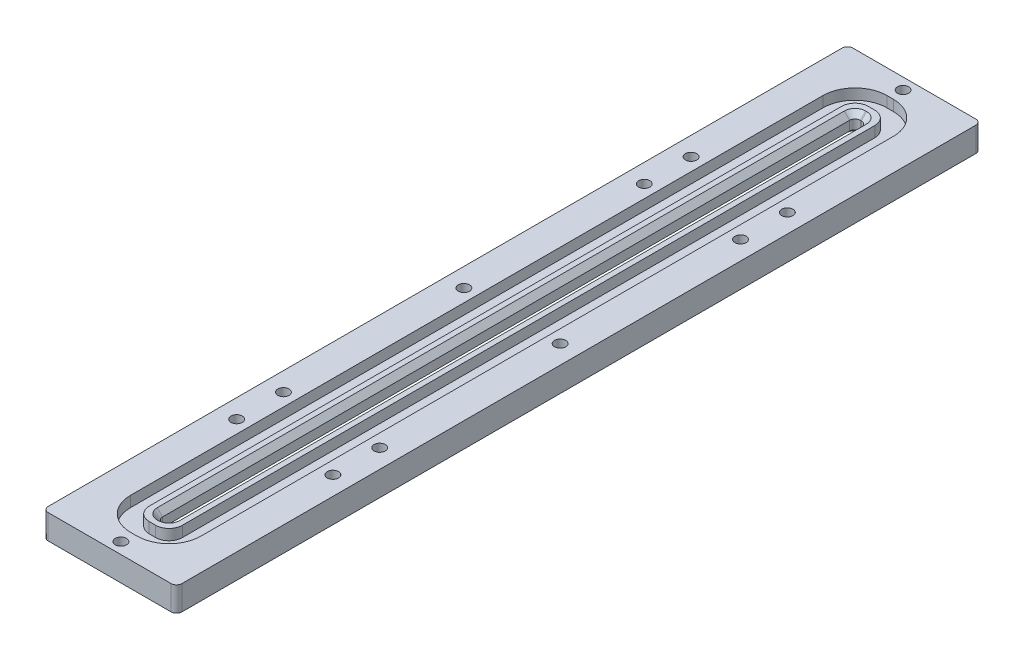
from build123d import *

# Parameters (mm, degrees)
BOSS_EXTRUDE1_DEPTH   = 137.5
SKETCH3_W             = 20
SKETCH3_H             = 9.2
BOSS_EXTRUDE2_DEPTH   = 2
SKETCH2_W             = 4.4
SKETCH2_H             = 261
CUT_EXTRUDE1_DEPTH    = 139.169786857
FILLET3_R             = 2
CHAMFER1_SIZE         = 1
SKETCH4_W             = 10.203047284
SKETCH4_H             = 4
CUT_EXTRUDE2_DEPTH    = 1
CHAMFER4_SIZE         = 2
SKETCH5_W             = 20
SKETCH5_H             = 275
BOSS_EXTRUDE3_DEPTH   = 9.2
M5_TAPPED_HOLE1_D     = 4.2
CRVPATTERN1_START     = -2.7
CRVPATTERN1_OUTLINE_R = 2.1
CRVPATTERN1_DEPTH     = 9.2
CUT_EXTRUDE3_DEPTH    = 4
M5_TAPPED_HOLE2_D     = 4.2
M5_TAPPED_HOLE2_DEPTH = 11.1381927
M5_TAPPED_HOLE2_TIP   = 1.2618073
FILLET4_R             = 2
CHAMFER5_SIZE         = 0.5


# Read off the part's stored shape, not the designer's step: CrvPattern1
with BuildPart() as part:
    # Sketch1 → Boss-Extrude1 (new, symmetric)
    with BuildSketch(Plane.XY):
        Polygon((-10, -2.7), (-10, 6.5), (10, 6.5), (10, -2.7), (8, -2.7), (8, 1), (4.2, 1), (4.2, 0), (-4.2, 0), (-4.2, 1), (-8, 1), (-8, -2.7), align=None)
    extrude(amount=BOSS_EXTRUDE1_DEPTH, both=True)

    # Sketch3 → Boss-Extrude2 (add)
    with BuildSketch(Plane.XY.offset(137.5)):
        with Locations((0, 1.9)):
            Rectangle(SKETCH3_W, SKETCH3_H)
    boss_extrude2 = extrude(amount=-BOSS_EXTRUDE2_DEPTH)

    # Mirror1: Boss-Extrude2 across plane
    add(boss_extrude2.mirror(Plane.XY))

    # Sketch2 → Cut-Extrude1 (cut, through all)
    with BuildSketch(Plane(origin=(0, 6.5, 0), x_dir=(1, 0, 0), z_dir=(0, 1, 0))):
        Rectangle(SKETCH2_W, SKETCH2_H)
    extrude(amount=-CUT_EXTRUDE1_DEPTH, mode=Mode.SUBTRACT)

    # Fillet3
    fillet3_edges = [part.edges().sort_by_distance(p)[0] for p in [
        (2.2, 3.25, -130.5),
        (2.2, 3.25, 130.5),
        (-2.2, 3.25, 130.5),
        (-2.2, 3.25, -130.5),
    ]]
    fillet(fillet3_edges, radius=FILLET3_R)

    # Chamfer1
    chamfer1_edges = [part.edges().sort_by_distance(p)[0] for p in [
        (-2.2, 0, 0),
        (0, 0, -130.5),
        (2.2, 0, 0),
        (0, 0, 130.5),
        (-1.614213562, 0, -129.914213562),
        (1.614213562, 0, -129.914213562),
        (1.614213562, 0, 129.914213562),
        (-1.614213562, 0, 129.914213562),
    ]]
    chamfer(chamfer1_edges, length=CHAMFER1_SIZE)

    # Sketch4 → Cut-Extrude2 (cut)
    with BuildSketch(Plane.XZ):
        with Locations((-0.901523642, 133.5)):
            Rectangle(SKETCH4_W, SKETCH4_H)
    cut_extrude2 = extrude(amount=-CUT_EXTRUDE2_DEPTH, mode=Mode.SUBTRACT)

    # Mirror2: Cut-Extrude2 across plane
    add(cut_extrude2.mirror(Plane.XY), mode=Mode.SUBTRACT)

    # Chamfer4
    chamfer4_edges = [part.edges().sort_by_distance(p)[0] for p in [
        (-2.2, 6.5, 0),
        (0, 6.5, -130.5),
        (2.2, 6.5, 0),
        (0, 6.5, 130.5),
        (-1.614213562, 6.5, -129.914213562),
        (1.614213562, 6.5, -129.914213562),
        (1.614213562, 6.5, 129.914213562),
        (-1.614213562, 6.5, 129.914213562),
    ]]
    chamfer(chamfer4_edges, length=CHAMFER4_SIZE)

    # Sketch5 → Boss-Extrude3 (add)
    with BuildSketch(Plane(origin=(0, 6.5, 0), x_dir=(1, 0, 0), z_dir=(0, 1, 0))):
        Polygon((-25, 137.5), (-25, -137.5), (-25, -150.5), (25, -150.5), (25, -137.5), (25, 137.5), (25, 150.5), (-25, 150.5), align=None)
        Rectangle(SKETCH5_W, SKETCH5_H, mode=Mode.SUBTRACT)
    extrude(amount=-BOSS_EXTRUDE3_DEPTH)

    # M5 Tapped Hole1 (through all)
    with Locations(Plane(origin=(0, 6.5, 0), x_dir=(1, 0, 0), z_dir=(0, 1, 0))):
        with Locations((-18, 0)):
            Hole(M5_TAPPED_HOLE1_D / 2)

    # CrvPattern1 outline → CrvPattern1 (cut)
    with BuildSketch(Plane(origin=(0, 0, 0), x_dir=(1, 0, 0), z_dir=(0, 1, 0)).offset(CRVPATTERN1_START)):
        with Locations((-18, -67.49253334)):
            Circle(CRVPATTERN1_OUTLINE_R)
        with Locations((0, -146.3)):
            Circle(CRVPATTERN1_OUTLINE_R)
        with Locations((18, -67.49253334)):
            Circle(CRVPATTERN1_OUTLINE_R)
        with Locations((18, 0)):
            Circle(CRVPATTERN1_OUTLINE_R)
        with Locations((18, 67.49253334)):
            Circle(CRVPATTERN1_OUTLINE_R)
        with Locations((0, 146.3)):
            Circle(CRVPATTERN1_OUTLINE_R)
        with Locations((-18, 67.49253334)):
            Circle(CRVPATTERN1_OUTLINE_R)
    extrude(amount=CRVPATTERN1_DEPTH, mode=Mode.SUBTRACT)

    # Sketch9 → Cut-Extrude3 (cut)
    with BuildSketch(Plane(origin=(0, 6.5, 0), x_dir=(1, 0, 0), z_dir=(0, 1, 0))):
        with BuildLine():
            Line((-1.2, -141.5), (1.2, -141.5))
            ThreePointArc((1.2, -141.5), (9.685281374, -137.985281374), (13.2, -129.5))
            Line((13.2, -129.5), (13.2, 129.5))
            ThreePointArc((13.2, 129.5), (9.685281374, 137.985281374), (1.2, 141.5))
            Line((1.2, 141.5), (-1.2, 141.5))
            ThreePointArc((-1.2, 141.5), (-9.685281374, 137.985281374), (-13.2, 129.5))
            Line((-13.2, 129.5), (-13.2, -129.5))
            ThreePointArc((-13.2, -129.5), (-9.685281374, -137.985281374), (-1.2, -141.5))
        make_face()
        with BuildLine():
            Line((-6.2, -129.5), (-6.2, 129.5))
            ThreePointArc((-6.2, 129.5), (-4.735533906, 133.035533906), (-1.2, 134.5))
            Line((-1.2, 134.5), (1.2, 134.5))
            ThreePointArc((1.2, 134.5), (4.735533906, 133.035533906), (6.2, 129.5))
            Line((6.2, 129.5), (6.2, -129.5))
            ThreePointArc((6.2, -129.5), (4.735533906, -133.035533906), (1.2, -134.5))
            Line((1.2, -134.5), (-1.2, -134.5))
            ThreePointArc((-1.2, -134.5), (-4.735533906, -133.035533906), (-6.2, -129.5))
        make_face(mode=Mode.SUBTRACT)
    extrude(amount=-CUT_EXTRUDE3_DEPTH, mode=Mode.SUBTRACT)

    # M5 Tapped Hole2
    with Locations(Plane(origin=(0, -2.7, 0), x_dir=(-1, 0, 0), z_dir=(0, -1, 0))):
        with Locations((18, 85), (18, -85), (-18, -85), (-18, 85)):
            Hole(M5_TAPPED_HOLE2_D / 2, depth=M5_TAPPED_HOLE2_DEPTH)
            with Locations((0, 0, -(M5_TAPPED_HOLE2_DEPTH + M5_TAPPED_HOLE2_TIP / 2))):  # 118° drill point
                Cone(0, M5_TAPPED_HOLE2_D / 2, M5_TAPPED_HOLE2_TIP, mode=Mode.SUBTRACT)

    # Fillet4
    fillet4_edges = [part.edges().sort_by_distance(p)[0] for p in [
        (-25, 1.9, 150.5),
        (-25, 1.9, -150.5),
        (25, 1.9, -150.5),
        (25, 1.9, 150.5),
    ]]
    fillet(fillet4_edges, radius=FILLET4_R)

    # Chamfer5
    chamfer5_edges = [part.edges().sort_by_distance(p)[0] for p in [
        (8, -2.7, 0),
        (-8, -2.7, 0),
        (0, -2.7, 135.5),
        (0, -2.7, -135.5),
    ]]
    chamfer(chamfer5_edges, length=CHAMFER5_SIZE)


solid = part.part
